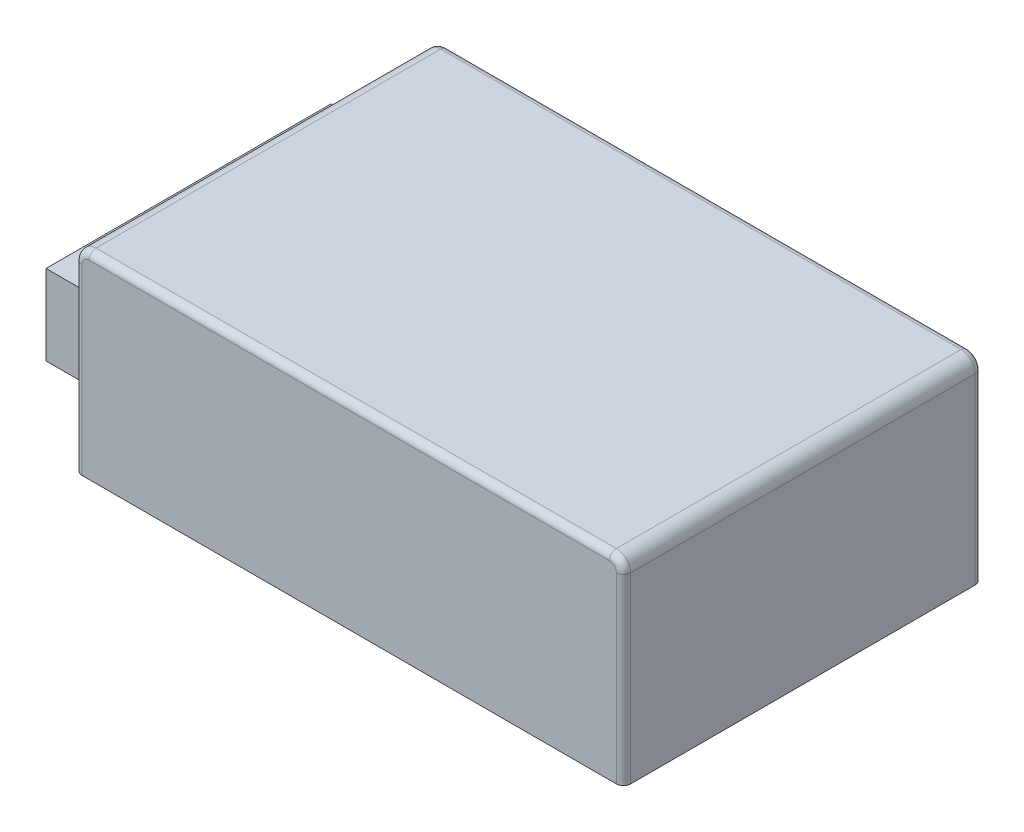
from build123d import *

# Parameters (mm, degrees)
SKETCH1_W           = 78
SKETCH1_H           = 51
BOSS_EXTRUDE1_DEPTH = 28
SKETCH2_R           = 1.5
CUT_EXTRUDE1_DEPTH  = 5
SKETCH3_W           = 40.53601249
SKETCH3_H           = 11.390631449
BOSS_EXTRUDE2_DEPTH = 12
FILLET1_R           = 2
FILLET2_R           = 1
SHELL3_START        = 2
SHELL3_OUTLINE_W    = 74
SHELL3_OUTLINE_H    = 47
SHELL3_OUTLINE_R    = 3.5
SHELL3_DEPTH        = 24
SHELL3_START_2      = 7
SHELL3_2_OUTLINE_R  = 3.5
SHELL3_2_DEPTH      = 19
SKETCH5_W           = 72
SKETCH5_H           = 45
BOSS_EXTRUDE3_DEPTH = 1.6
SKETCH6_W           = 20.344550397
SKETCH6_H           = 22.088359597
BOSS_EXTRUDE4_DEPTH = 16


# Read off the part's stored shape, not the designer's step: Shell3
with BuildPart() as part:
    # Sketch1 → Boss-Extrude1 (new body)
    with BuildSketch(Plane(origin=(0, 0, 0), x_dir=(1, 0, 0), z_dir=(0, 1, 0))):
        with Locations((39, 25.5)):
            Rectangle(SKETCH1_W, SKETCH1_H)
    extrude(amount=BOSS_EXTRUDE1_DEPTH)

    # Sketch2 → Cut-Extrude1 (cut)
    with BuildSketch(Plane.XZ):
        with Locations(Location((67, -25.6, 0), (0, 0, 270))):
            Circle(SKETCH2_R)
        with Locations(Location((12, -25.6, 0), (0, 0, 270))):
            Circle(SKETCH2_R)
    extrude(amount=-CUT_EXTRUDE1_DEPTH, mode=Mode.SUBTRACT)

    # Fillet1
    fillet1_edges = [part.edges().sort_by_distance(p)[0] for p in [
        (78, 28, -25.5),
        (0, 28, -25.5),
    ]]
    fillet(fillet1_edges, radius=FILLET1_R)

    # Fillet2
    fillet2_edges = [part.edges().sort_by_distance(p)[0] for p in [
        (39, 28, 0),
        (39, 28, -51),
        (0, 13, -51),
        (78, 13, -51),
        (0.585786438, 27.414213562, -51),
        (77.414213562, 27.414213562, -51),
        (78, 13, 0),
        (0, 13, 0),
        (0.585786438, 27.414213562, 0),
        (77.414213562, 27.414213562, 0),
    ]]
    fillet(fillet2_edges, radius=FILLET2_R)

    # Shell3 outline → Shell3 (cut)
    with BuildSketch(Plane(origin=(0, 0, 0), x_dir=(1, 0, 0), z_dir=(0, 1, 0)).offset(SHELL3_START)):
        with Locations((39, 25.5)):
            Rectangle(SHELL3_OUTLINE_W, SHELL3_OUTLINE_H)
        with Locations((12, 25.6)):
            Circle(SHELL3_OUTLINE_R, mode=Mode.SUBTRACT)
        with Locations((67, 25.6)):
            Circle(SHELL3_OUTLINE_R, mode=Mode.SUBTRACT)
    extrude(amount=SHELL3_DEPTH, mode=Mode.SUBTRACT)

    # Shell3 2 outline → Shell3 2 (cut)
    with BuildSketch(Plane(origin=(0, 0, 0), x_dir=(1, 0, 0), z_dir=(0, 1, 0)).offset(SHELL3_START_2)):
        with Locations((12, 25.6)):
            Circle(SHELL3_2_OUTLINE_R)
        with Locations((67, 25.6)):
            Circle(SHELL3_2_OUTLINE_R)
    extrude(amount=SHELL3_2_DEPTH, mode=Mode.SUBTRACT)


with BuildPart() as body_2:
    # Sketch3 → Boss-Extrude2 (new body)
    with BuildSketch(Plane.ZY):
        with Locations((-28.152164423, 9.351775934)):
            Rectangle(SKETCH3_W, SKETCH3_H)
    extrude(amount=BOSS_EXTRUDE2_DEPTH)


with BuildPart() as body_3:
    # Sketch5 → Boss-Extrude3 (new body)
    with BuildSketch(Plane(origin=(0, 7, 0), x_dir=(1, 0, 0), z_dir=(0, 1, 0))):
        with Locations((39, 25.5)):
            Rectangle(SKETCH5_W, SKETCH5_H)
    extrude(amount=BOSS_EXTRUDE3_DEPTH)

    # Sketch6 → Boss-Extrude4 (add)
    with BuildSketch(Plane(origin=(0, 8.6, 0), x_dir=(1, 0, 0), z_dir=(0, 1, 0))):
        with Locations((33.357185466, 22.98504657)):
            Rectangle(SKETCH6_W, SKETCH6_H)
    extrude(amount=BOSS_EXTRUDE4_DEPTH)


solid = Compound([part.part, body_2.part, body_3.part])
